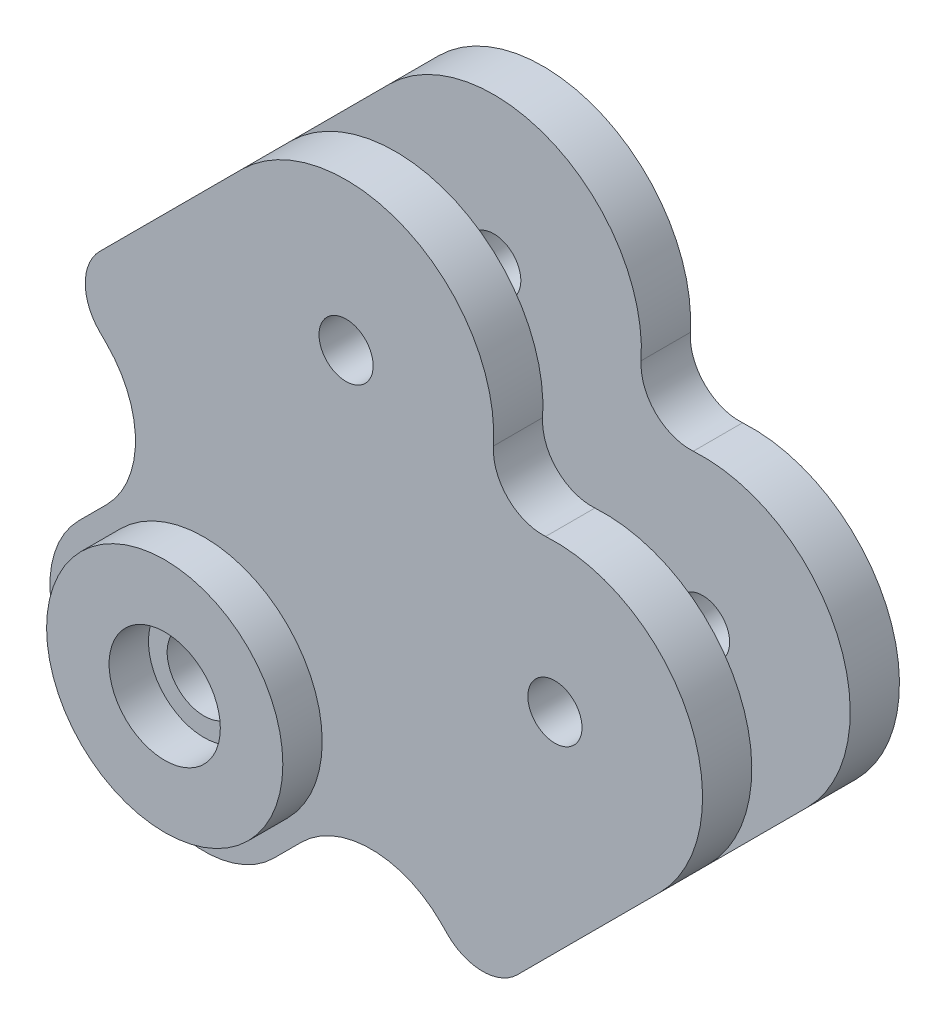
from build123d import *

# Parameters (mm, degrees)
SKETCH2_R               = 2.75
BOSS_EXTRUDE2_DEPTH     = 5
SKETCH3_R               = 2.75
BOSS_EXTRUDE3_DEPTH     = 5
SKETCH4_W               = 20
SKETCH4_H               = 60
BOSS_EXTRUDE4_DEPTH     = 5
FILLET1_R               = 5
SKETCH5_W               = 8
SKETCH5_H               = 10
BOSS_EXTRUDE5_DEPTH     = 20
FILLET3_START           = -16
FILLET3_DEPTH           = 22
CUT_EXTRUDE1_DEPTH      = 385.295668221
CUT_EXTRUDE1_DEPTH_BACK = 385.295668221
SKETCH8_R               = 9
SKETCH8_R_2             = 5.65
BOSS_EXTRUDE6_DEPTH     = 4
BOSS_EXTRUDE7_START     = 4
SKETCH9_R               = 9
SKETCH9_R_2             = 5.65
BOSS_EXTRUDE7_DEPTH     = 4
CUT_EXTRUDE2_DEPTH      = 2.5
CUT_EXTRUDE3_DEPTH      = 2.5
SKETCH12_W              = 5.5
SKETCH12_H              = 20
BOSS_EXTRUDE8_DEPTH     = 4
SKETCH13_W              = 5.5
SKETCH13_H              = 20
BOSS_EXTRUDE9_DEPTH     = 4
SKETCH14_W              = 5.5
SKETCH14_H              = 28
BOSS_EXTRUDE10_DEPTH    = 4
FILLET4_R               = 10
SKETCH16_R              = 12
SKETCH16_R_2            = 5.65
BOSS_EXTRUDE11_DEPTH    = 4
BOSS_EXTRUDE12_START    = 4
SKETCH17_R              = 12
SKETCH17_R_2            = 5.65
BOSS_EXTRUDE12_DEPTH    = 4


with BuildPart() as part:
    # Sketch2 → Boss-Extrude2 (new body)
    with BuildSketch(Plane.XY):
        with BuildLine():
            ThreePointArc((-79.393398282, 339.393398282), (-79.393398282, 360.606601718), (-100.606601718, 360.606601718))
            Line((-100.606601718, 360.606601718), (-115.031580054, 346.181623382))
            Line((-115.031580054, 346.181623382), (-72.605173183, 303.75521651))
            Line((-72.605173183, 303.75521651), (-58.180194847, 318.180194847))
            ThreePointArc((-58.180194847, 318.180194847), (-58.180194847, 339.393398282), (-79.393398282, 339.393398282))
        make_face()
        with Locations((-90, 350)):
            Circle(SKETCH2_R, mode=Mode.SUBTRACT)
        with Locations((-68.786796564, 328.786796564)):
            Circle(SKETCH2_R, mode=Mode.SUBTRACT)
    extrude(amount=BOSS_EXTRUDE2_DEPTH)



with BuildPart() as body_2:
    # Sketch3 → Boss-Extrude3 (new body)
    with BuildSketch(Plane(origin=(0, 0, -10), x_dir=(-1, 0, 0), z_dir=(0, 0, -1))):
        with BuildLine():
            Line((72.605173183, 303.75521651), (115.031580054, 346.181623382))
            Line((115.031580054, 346.181623382), (100.606601718, 360.606601718))
            ThreePointArc((100.606601718, 360.606601718), (79.393398282, 360.606601718), (79.393398282, 339.393398282))
            ThreePointArc((79.393398282, 339.393398282), (58.180194847, 339.393398282), (58.180194847, 318.180194847))
            Line((58.180194847, 318.180194847), (72.605173183, 303.75521651))
        make_face()
        with Locations(Location((90, 350, 0), (0, 0, 180))):
            Circle(SKETCH3_R, mode=Mode.SUBTRACT)
        with Locations(Location((68.786796564, 328.786796564, 0), (0, 0, 180))):
            Circle(SKETCH3_R, mode=Mode.SUBTRACT)
    extrude(amount=BOSS_EXTRUDE3_DEPTH)


with BuildPart() as part_1:
    add(part.part)

    add(body_2.part)  # Boss-Extrude4 merges body 2
    # Sketch4 → Boss-Extrude4 (add)
    with BuildSketch(Plane(origin=(115.575021664, 115.575021664, 0), x_dir=(0, 0, 1), z_dir=(-0.7071067811865471, -0.707106781186548, 0))):
        with Locations((-5, 296.126983722)):
            Rectangle(SKETCH4_W, SKETCH4_H)
    extrude(amount=BOSS_EXTRUDE4_DEPTH)

    # Fillet1
    fillet1_edges = [part_1.edges().sort_by_distance(p)[0] for p in [
        (-79.393398282, 339.393398282, 2.5),
        (-79.393398282, 339.393398282, -12.5),
    ]]
    fillet(fillet1_edges, radius=FILLET1_R)

    # Sketch5 → Boss-Extrude5 (add)
    with BuildSketch(Plane(origin=(112.039487758, 112.039487758, 0), x_dir=(0, 0, 1), z_dir=(-0.7071067811865477, -0.7071067811865475, 0))):
        with Locations((1, 301.126983722)):
            Rectangle(SKETCH5_W, SKETCH5_H)
        with Locations((-11, 301.126983722)):
            Rectangle(SKETCH5_W, SKETCH5_H)
        with Locations((-11, 291.126983722)):
            Rectangle(SKETCH5_W, SKETCH5_H)
        with Locations((1, 291.126983722)):
            Rectangle(SKETCH5_W, SKETCH5_H)
    extrude(amount=BOSS_EXTRUDE5_DEPTH)

    # Fillet3: read off the stored shape, not the designer's step
    # Fillet3 outline → Fillet3 (cut)
    with BuildSketch(Plane.XY.offset(FILLET3_START)):
        with BuildLine():
            Line((-118.56711396, 342.646089476), (-115.031580054, 339.11055557))
            ThreePointArc((-115.031580054, 339.11055557), (-116.496046148, 342.646089476), (-115.031580054, 346.181623382))
            Line((-115.031580054, 346.181623382), (-118.56711396, 342.646089476))
        make_face()
        with BuildLine():
            ThreePointArc((-72.605173183, 303.75521651), (-76.140707089, 302.290750416), (-79.676240995, 303.75521651))
            Line((-79.676240995, 303.75521651), (-76.140707089, 300.219682604))
            Line((-76.140707089, 300.219682604), (-72.605173183, 303.75521651))
        make_face()
    extrude(amount=FILLET3_DEPTH, mode=Mode.SUBTRACT)

    # Sketch7 → Cut-Extrude1 (cut, two sides: drawn at the far end of the back side and taken through both)
    with BuildSketch(Plane.XY.offset(5).offset(-CUT_EXTRUDE1_DEPTH_BACK)):
        with BuildLine():
            ThreePointArc((-100.674978336, 314.361818228), (-102.989915465, 317.826366475), (-107.076628766, 317.013468658))
            Line((-107.076628766, 317.013468658), (-101.773327907, 311.710167799))
            ThreePointArc((-101.773327907, 311.710167799), (-100.960430089, 312.926755357), (-100.674978336, 314.361818228))
        make_face()
        with BuildLine():
            Line((-101.773327907, 311.710167799), (-107.076628766, 317.013468658))
            ThreePointArc((-107.076628766, 317.013468658), (-107.076628766, 311.710167799), (-101.773327907, 311.710167799))
        make_face()
    extrude(amount=CUT_EXTRUDE1_DEPTH + CUT_EXTRUDE1_DEPTH_BACK, mode=Mode.SUBTRACT)

    # Sketch8 → Boss-Extrude6 (add)
    with BuildSketch(Plane(origin=(0, 0, -15), x_dir=(-1, 0, 0), z_dir=(0, 0, -1))):
        with Locations((104.424978336, 314.361818228)):
            Circle(SKETCH8_R)
        with Locations((104.424978336, 314.361818228)):
            Circle(SKETCH8_R_2, mode=Mode.SUBTRACT)
    extrude(amount=BOSS_EXTRUDE6_DEPTH)

    # Sketch9 → Boss-Extrude7 (add)
    with BuildSketch(Plane.XY.offset(5).offset(BOSS_EXTRUDE7_START)):
        with Locations(Location((-104.424978336, 314.361818228, 0), (0, 0, 180))):
            Circle(SKETCH9_R)
        with Locations(Location((-104.424978336, 314.361818228, 0), (0, 0, 180))):
            Circle(SKETCH9_R_2, mode=Mode.SUBTRACT)
    extrude(amount=-BOSS_EXTRUDE7_DEPTH)

    # Sketch10 → Cut-Extrude2 (cut)
    with BuildSketch(Plane.XY.offset(-7)):
        Polygon((-118.56711396, 314.361818228), (-104.424978336, 300.219682604), (-90.282842712, 314.361818228), (-104.424978336, 328.503953852), align=None)
    extrude(amount=-CUT_EXTRUDE2_DEPTH, mode=Mode.SUBTRACT)

    # Sketch11 → Cut-Extrude3 (cut)
    with BuildSketch(Plane(origin=(0, 0, -3), x_dir=(-1, 0, 0), z_dir=(0, 0, -1))):
        Polygon((90.282842712, 314.361818228), (104.424978336, 300.219682604), (118.56711396, 314.361818228), (104.424978336, 328.503953852), align=None)
    extrude(amount=-CUT_EXTRUDE3_DEPTH, mode=Mode.SUBTRACT)

    # Sketch12 → Boss-Extrude8 (add)
    with BuildSketch(Plane(origin=(-216.464466094, 216.464466094, 0), x_dir=(0, 0, 1), z_dir=(-0.7071067811865476, 0.7071067811865476, 0))):
        with Locations((-12.25, 148.447763109)):
            Rectangle(SKETCH12_W, SKETCH12_H)
        with Locations((2.25, 148.447763109)):
            Rectangle(SKETCH12_W, SKETCH12_H)
    extrude(amount=BOSS_EXTRUDE8_DEPTH)

    # Sketch13 → Boss-Extrude9 (add)
    with BuildSketch(Plane(origin=(-202.32233047, 202.32233047, 0), x_dir=(0, 0, -1), z_dir=(0.7071067811865476, -0.7071067811865476, 0))):
        with Locations((12.25, 148.447763109)):
            Rectangle(SKETCH13_W, SKETCH13_H)
        with Locations((-2.25, 148.447763109)):
            Rectangle(SKETCH13_W, SKETCH13_H)
    extrude(amount=BOSS_EXTRUDE9_DEPTH)

    # Sketch14 → Boss-Extrude10 (add)
    with BuildSketch(Plane(origin=(97.897352134, 97.897352134, 0), x_dir=(0, 0, 1), z_dir=(-0.7071067811865476, -0.7071067811865476, 0))):
        with Locations((2.25, 296.126983722)):
            Rectangle(SKETCH14_W, SKETCH14_H)
        with Locations((-12.25, 296.126983722)):
            Rectangle(SKETCH14_W, SKETCH14_H)
    extrude(amount=BOSS_EXTRUDE10_DEPTH)

    # Fillet4
    fillet4_edges = [part_1.edges().sort_by_distance(p)[0] for p in [
        (-107.253405461, 331.332380977, -12.25),
        (-107.253405461, 331.332380977, 2.25),
        (-87.454415588, 311.533391103, -12.25),
        (-87.454415588, 311.533391103, 2.25),
        (-104.424978336, 294.562828355, 2.25),
        (-124.223968209, 314.361818228, 2.25),
        (-124.223968209, 314.361818228, -12.25),
        (-104.424978336, 294.562828355, -12.25),
    ]]
    fillet(fillet4_edges, radius=FILLET4_R)

    # Sketch16 → Boss-Extrude11 (add)
    with BuildSketch(Plane(origin=(0, 0, -15), x_dir=(-1, 0, 0), z_dir=(0, 0, -1))):
        with Locations(Location((104.424978336, 314.361818228, 0), (0, 0, 180))):
            Circle(SKETCH16_R)
        with Locations((104.424978336, 314.361818228)):
            Circle(SKETCH16_R_2, mode=Mode.SUBTRACT)
    extrude(amount=BOSS_EXTRUDE11_DEPTH)

    # Sketch17 → Boss-Extrude12 (add)
    with BuildSketch(Plane.XY.offset(5).offset(BOSS_EXTRUDE12_START)):
        with Locations((-104.424978336, 314.361818228)):
            Circle(SKETCH17_R)
        with Locations(Location((-104.424978336, 314.361818228, 0), (0, 0, 180))):
            Circle(SKETCH17_R_2, mode=Mode.SUBTRACT)
    extrude(amount=-BOSS_EXTRUDE12_DEPTH)


solid = part_1.part
